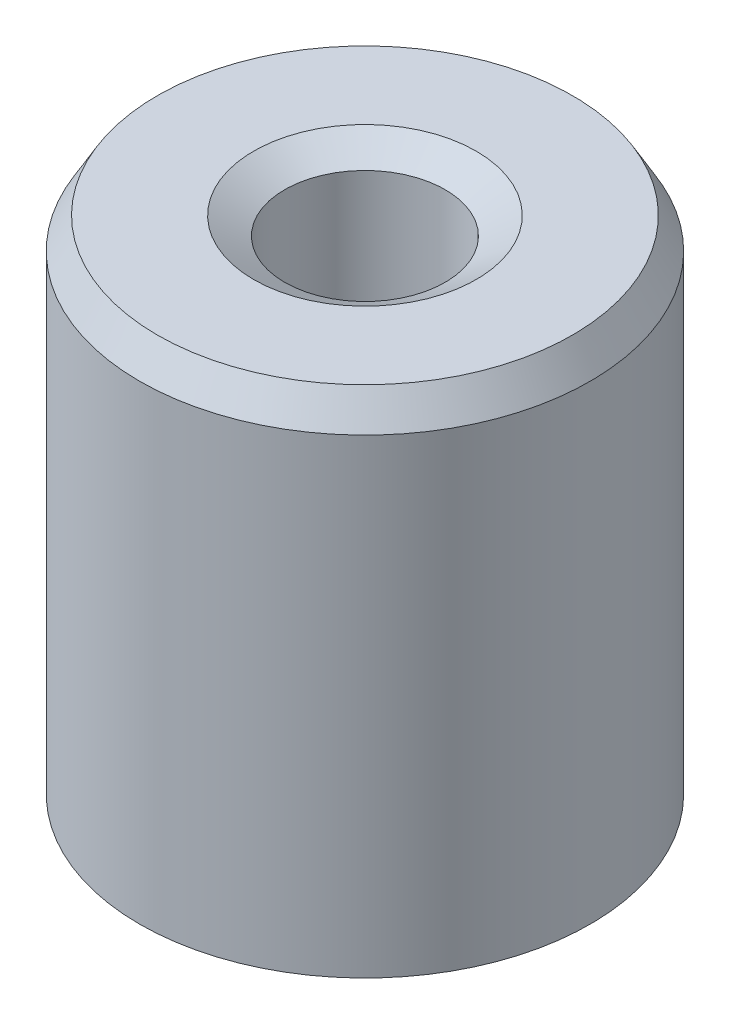
from build123d import *
from OCP.BRepFilletAPI import BRepFilletAPI_MakeChamfer

# Parameters (mm, degrees)
SKETCH1_R           = 7.5
BOSS_EXTRUDE1_DEPTH = 17.273650876
SKETCH2_R           = 2.671727995
CUT_EXTRUDE1_DEPTH  = 21.270150828
CHAMFER1_SIZE       = 1.03091455
CHAMFER1_SIZE2      = 0.595198793


with BuildPart() as part:
    # Sketch1 → Boss-Extrude1 (new body)
    with BuildSketch(Plane(origin=(0, 0, 0), x_dir=(1, 0, 0), z_dir=(0, 1, 0))):
        Circle(SKETCH1_R)
    extrude(amount=BOSS_EXTRUDE1_DEPTH)

    # Sketch2 → Cut-Extrude1 (cut, through all)
    with BuildSketch(Plane(origin=(0, 0, 0), x_dir=(1, 0, 0), z_dir=(0, 1, 0))):
        Circle(SKETCH2_R)
    extrude(amount=CUT_EXTRUDE1_DEPTH, mode=Mode.SUBTRACT)

    # Chamfer1: one chamfer whose edges measure the first distance from different faces: ONE call of the kernel's chamfer builder (chamfer() names one face for all edges)
    chamfer1_edges_1 = [part.edges().sort_by_distance(p)[0] for p in [
        (-2.671727995, 17.273650876, 0),
    ]]
    chamfer1_side_1 = [part.faces().sort_by_distance(p)[0] for p in [
        (-7.287867966, 17.273650876, 0),
    ]]
    chamfer1_edges_2 = [part.edges().sort_by_distance(p)[0] for p in [
        (-2.671727995, 0, 0),
    ]]
    chamfer1_side_2 = [part.faces().sort_by_distance(p)[0] for p in [
        (-2.671727995, 8.636825438, 0),
    ]]
    chamfer1_edges_3 = [part.edges().sort_by_distance(p)[0] for p in [
        (-7.5, 0, 0),
    ]]
    chamfer1_side_3 = [part.faces().sort_by_distance(p)[0] for p in [
        (-7.287867966, 0, 0),
    ]]
    chamfer1_edges_4 = [part.edges().sort_by_distance(p)[0] for p in [
        (-7.5, 17.273650876, 0),
    ]]
    chamfer1_side_4 = [part.faces().sort_by_distance(p)[0] for p in [
        (-7.5, 8.636825438, 0),
    ]]
    chamfer1 = BRepFilletAPI_MakeChamfer(part.part.solid().wrapped)
    for e in chamfer1_edges_1:
        chamfer1.Add(CHAMFER1_SIZE, CHAMFER1_SIZE2, e.wrapped, chamfer1_side_1[0].wrapped)  # the first distance lies on this face
    for e in chamfer1_edges_2:
        chamfer1.Add(CHAMFER1_SIZE, CHAMFER1_SIZE2, e.wrapped, chamfer1_side_2[0].wrapped)  # the first distance lies on this face
    for e in chamfer1_edges_3:
        chamfer1.Add(CHAMFER1_SIZE, CHAMFER1_SIZE2, e.wrapped, chamfer1_side_3[0].wrapped)  # the first distance lies on this face
    for e in chamfer1_edges_4:
        chamfer1.Add(CHAMFER1_SIZE, CHAMFER1_SIZE2, e.wrapped, chamfer1_side_4[0].wrapped)  # the first distance lies on this face
    add(Compound.cast(chamfer1.Shape()), mode=Mode.REPLACE)


solid = part.part
